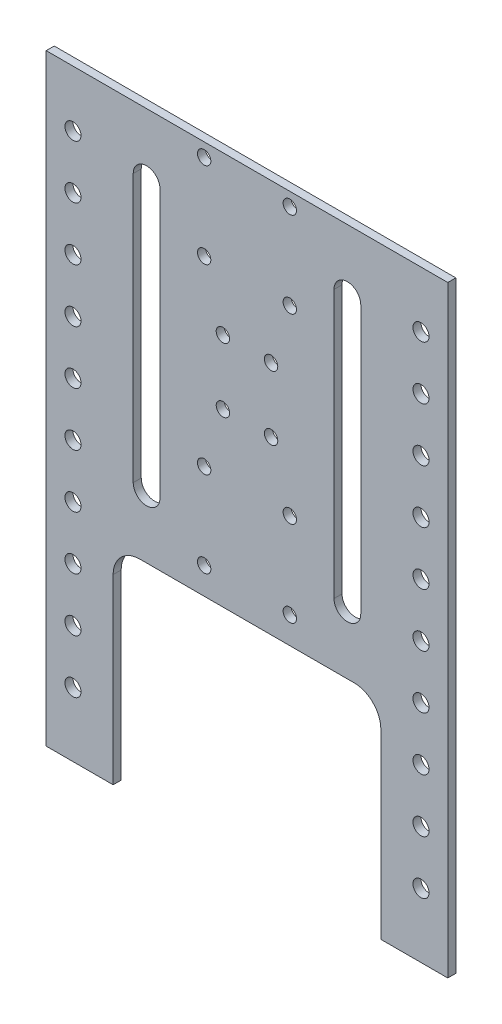
from build123d import *

# Parameters (mm, degrees)
SKETCH1_W          = 150
SKETCH1_H          = 225
BASE_FLANGE1_DEPTH = 3
SKETCH6_R          = 2.5
SKETCH6_R_2        = 3
CUT_EXTRUDE1_DEPTH = 10
CUT_EXTRUDE2_DEPTH = 10


# Sheet-metal steps are written as plain solids
with BuildPart() as part:
    # Sketch1 → Base-Flange1 (new body)
    with BuildSketch(Plane.XY):
        Rectangle(SKETCH1_W, SKETCH1_H)
    extrude(amount=BASE_FLANGE1_DEPTH)

    # Sketch6 → Cut-Extrude1 (cut)
    with BuildSketch(Plane.XY.offset(3)):
        with Locations((16, 107.5)):
            Circle(SKETCH6_R)
        with Locations((-16, 107.5)):
            Circle(SKETCH6_R)
        with Locations((-16, 75.5)):
            Circle(SKETCH6_R)
        with Locations((16, 75.5)):
            Circle(SKETCH6_R)
        with Locations((9, 53.5)):
            Circle(SKETCH6_R)
        with Locations(Location((16, 7.5, 0), (0, 0, 180))):
            Circle(SKETCH6_R)
        with Locations(Location((16, -24.5, 0), (0, 0, 180))):
            Circle(SKETCH6_R)
        with Locations(Location((-16, 7.5, 0), (0, 0, 180))):
            Circle(SKETCH6_R)
        with Locations(Location((-16, -24.5, 0), (0, 0, 180))):
            Circle(SKETCH6_R)
        with Locations((65, 91.5)):
            Circle(SKETCH6_R_2)
        with Locations((65, 71.5)):
            Circle(SKETCH6_R_2)
        with Locations((65, 51.5)):
            Circle(SKETCH6_R_2)
        with Locations((65, 31.5)):
            Circle(SKETCH6_R_2)
        with Locations((65, 11.5)):
            Circle(SKETCH6_R_2)
        with Locations((65, -8.5)):
            Circle(SKETCH6_R_2)
        with Locations((65, -28.5)):
            Circle(SKETCH6_R_2)
        with Locations((65, -48.5)):
            Circle(SKETCH6_R_2)
        with Locations(Location((-65, -48.5, 0), (0, 0, 180))):
            Circle(SKETCH6_R_2)
        with Locations(Location((-65, -28.5, 0), (0, 0, 180))):
            Circle(SKETCH6_R_2)
        with Locations(Location((-65, -8.5, 0), (0, 0, 180))):
            Circle(SKETCH6_R_2)
        with Locations(Location((-65, 11.5, 0), (0, 0, 180))):
            Circle(SKETCH6_R_2)
        with Locations(Location((-65, 31.5, 0), (0, 0, 180))):
            Circle(SKETCH6_R_2)
        with Locations(Location((-65, 51.5, 0), (0, 0, 180))):
            Circle(SKETCH6_R_2)
        with Locations(Location((-65, 71.5, 0), (0, 0, 180))):
            Circle(SKETCH6_R_2)
        with Locations(Location((-65, 91.5, 0), (0, 0, 180))):
            Circle(SKETCH6_R_2)
        with Locations(Location((9, 29.5, 0), (0, 0, 180))):
            Circle(SKETCH6_R)
        with Locations((-9, 29.5)):
            Circle(SKETCH6_R)
        with Locations(Location((-9, 53.5, 0), (0, 0, 180))):
            Circle(SKETCH6_R)
        with Locations(Location((-65, -68.5, 0), (0, 0, 180))):
            Circle(SKETCH6_R_2)
        with Locations((65, -68.5)):
            Circle(SKETCH6_R_2)
        with Locations(Location((-65, -88.5, 0), (0, 0, 180))):
            Circle(SKETCH6_R_2)
        with Locations((65, -88.5)):
            Circle(SKETCH6_R_2)
    extrude(amount=-CUT_EXTRUDE1_DEPTH, mode=Mode.SUBTRACT)

    # Sketch7 → Cut-Extrude2 (cut)
    with BuildSketch(Plane.XY.offset(3)):
        with BuildLine():
            Line((-50, -112.5), (50, -112.5))
            Line((50, -112.5), (50, -44.5))
            ThreePointArc((50, -44.5), (47.071067812, -37.428932188), (40, -34.5))
            Line((40, -34.5), (-40, -34.5))
            ThreePointArc((-40, -34.5), (-47.071067812, -37.428932188), (-50, -44.5))
            Line((-50, -44.5), (-50, -112.5))
        make_face()
        with BuildLine():
            Line((-42.5, -11), (-42.5, 89))
            ThreePointArc((-42.5, 89), (-37.5, 94), (-32.5, 89))
            Line((-32.5, 89), (-32.5, -11))
            ThreePointArc((-32.5, -11), (-37.5, -16), (-42.5, -11))
        make_face()
        with BuildLine():
            Line((42.5, -11), (42.5, 89))
            ThreePointArc((42.5, 89), (37.5, 94), (32.5, 89))
            Line((32.5, 89), (32.5, -11))
            ThreePointArc((32.5, -11), (37.5, -16), (42.5, -11))
        make_face()
    extrude(amount=-CUT_EXTRUDE2_DEPTH, mode=Mode.SUBTRACT)


solid = part.part
